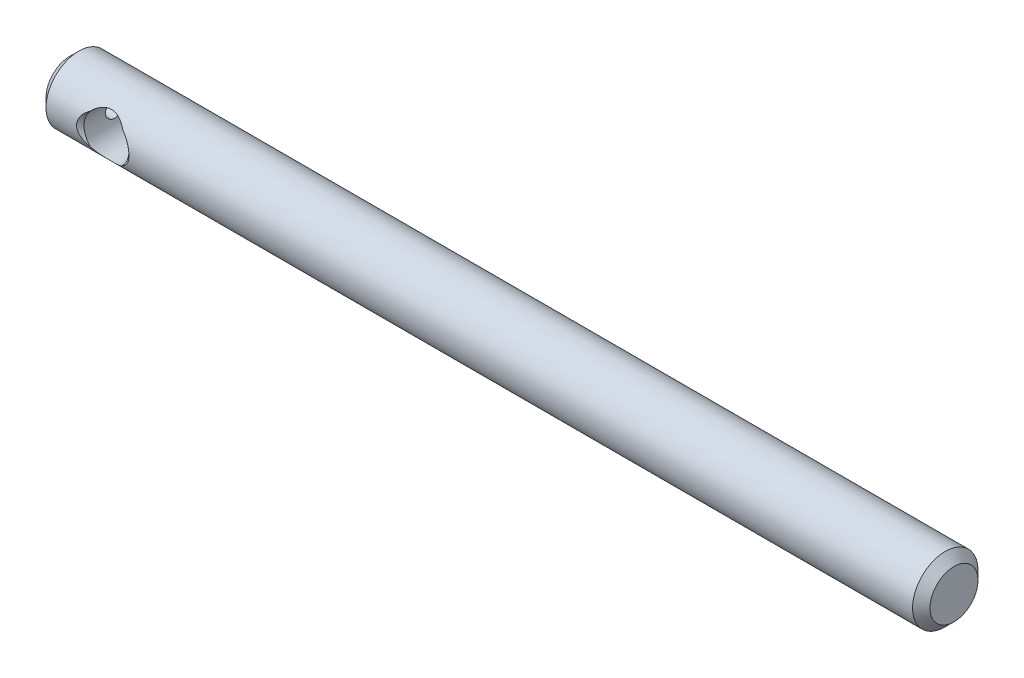
from build123d import *

# Parameters (mm, degrees)
SKETCH2_R           = 4.7625
BOSS_EXTRUDE1_DEPTH = 128.651
CHAMFER1_SIZE       = 1.27


# Read off the part's stored shape, not the designer's step: #4-40 Tapped Hole1
with BuildPart() as part:
    # Sketch2 → Boss-Extrude1 (new body)
    with BuildSketch(Plane(origin=(0, 0, 0), x_dir=(0, 0, -1), z_dir=(1, 0, 0))):
        with Locations(Location((0, 0, 0), (0, 0, 180))):
            Circle(SKETCH2_R)
    extrude(amount=BOSS_EXTRUDE1_DEPTH)

    # Chamfer1
    chamfer1_edges = [part.edges().sort_by_distance(p)[0] for p in [
        (0, 0, -4.7625),
        (128.651, 0, -4.7625),
    ]]
    chamfer(chamfer1_edges, length=CHAMFER1_SIZE)

    # Sketch9 → F (0.257) Diameter Hole2 (revolve, cut)
    with BuildSketch(Plane(origin=(9.525, 0, 4.7625), x_dir=(0, -1, 0), z_dir=(1, 0, 0))):
        Polygon((0, 0), (0, 9.525), (3.81, 9.525), (3.2639, 8.9789), (3.2639, 0.5461), (3.81, 0), align=None)
    revolve(axis=Axis((9.525, 0, 11.1125), (0, 0, -1)), mode=Mode.SUBTRACT)

    # #4-40 Tapped Hole1 outline → #4-40 Tapped Hole1 (revolve, cut)
    with BuildSketch(Plane.YX):
        Polygon((1.1303, 0.4572), (1.1303, 6.463087607), (0, 6.463087607), (0, 0), (1.5875, 0), align=None)
    revolve(axis=Axis((0, 0, 0), (1, 0, 0)), mode=Mode.SUBTRACT)


solid = part.part
